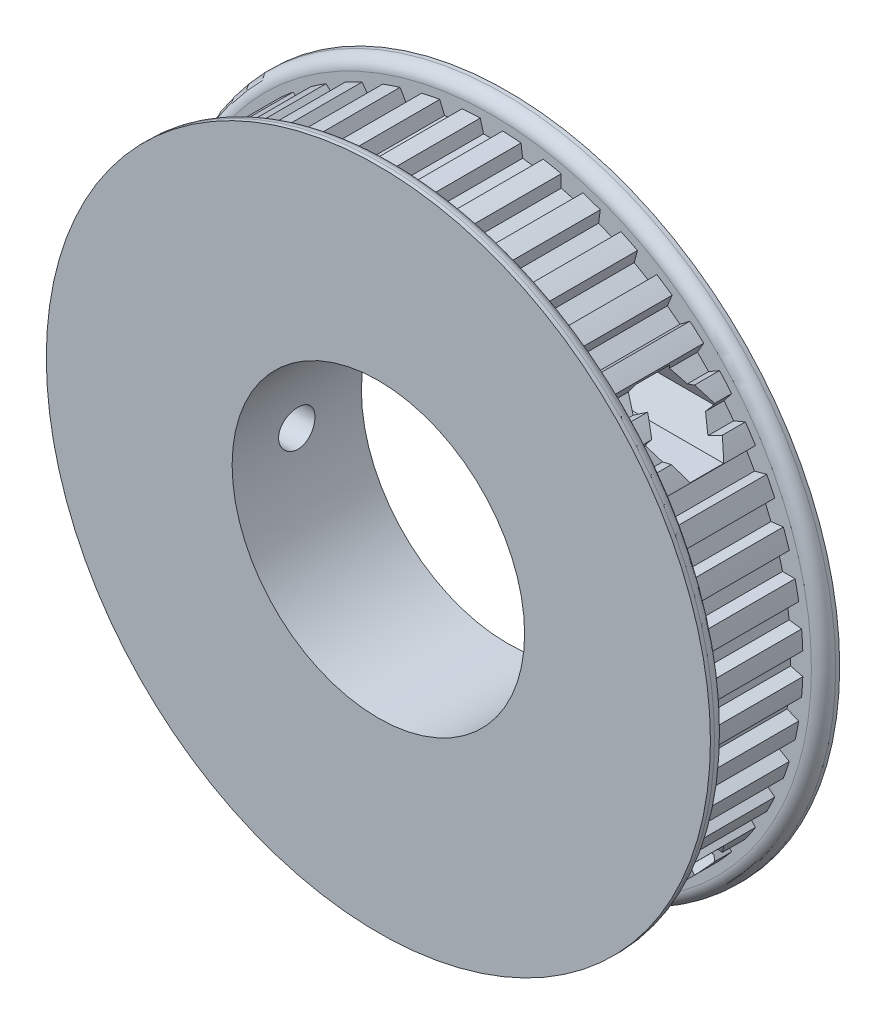
from build123d import *

# Parameters (mm, degrees)
SKETCH1_R               = 38.5572
BOSS_EXTRUDE1_DEPTH     = 6
CUT_EXTRUDE3_DEPTH      = 55.857226905
CUT_EXTRUDE3_DEPTH_BACK = 55.857226905
SKETCH6_R               = 18.1
SKETCH11_R              = 2.25
CUT_EXTRUDE4_DEPTH      = 55.857226905
CUT_EXTRUDE5_START      = -5
SKETCH12_R              = 4
CUT_EXTRUDE5_DEPTH      = 50.857227056
CUT_EXTRUDE6_START      = 5
CUT_EXTRUDE6_DEPTH      = 50.857227056
CUT_EXTRUDE8_START      = -38.557200101
CUT_EXTRUDE8_OUTLINE_R  = 2.25
CUT_EXTRUDE8_DEPTH      = 20.597592743
CUT_EXTRUDE9_START      = -25
SKETCH16_R              = 3.75
CUT_EXTRUDE9_DEPTH      = 30.857227127
CUT_EXTRUDE7_DEPTH      = 55.857227056
CIRPATTERN2_COUNT       = 48
SKETCH19_W              = 2
SKETCH19_H              = 23
FILLET2_R               = 1.5
FILLET2_OF_MIRROR2_R    = 1.5


# Read off the part's stored shape, not the designer's step: Cut-Extrude8
with BuildPart() as part:
    # Sketch1 → Boss-Extrude1 (new, symmetric)
    with BuildSketch(Plane.XY):
        Circle(SKETCH1_R)
    extrude(amount=BOSS_EXTRUDE1_DEPTH, both=True)

    # Sketch6 → Cut-Extrude3 (cut, two sides: drawn at the far end of the back side and taken through both)
    with BuildSketch(Plane.XY.offset(-CUT_EXTRUDE3_DEPTH_BACK)):
        Circle(SKETCH6_R)
    extrude(amount=CUT_EXTRUDE3_DEPTH + CUT_EXTRUDE3_DEPTH_BACK, mode=Mode.SUBTRACT)

    # Sketch11 → Cut-Extrude4 (cut, symmetric)
    with BuildSketch(Plane(origin=(0, 0, 0), x_dir=(0, 0, -1), z_dir=(1, 0, 0))):
        with Locations((0, 24.1)):
            Circle(SKETCH11_R)
    cut_extrude4 = extrude(amount=CUT_EXTRUDE4_DEPTH, both=True, mode=Mode.SUBTRACT)

    # Sketch12 → Cut-Extrude5 (cut, through all)
    with BuildSketch(Plane(origin=(0, 0, 0), x_dir=(0, 0, -1), z_dir=(1, 0, 0)).offset(CUT_EXTRUDE5_START)):
        with Locations((0, 24.1)):
            Circle(SKETCH12_R)
    cut_extrude5 = extrude(amount=-CUT_EXTRUDE5_DEPTH, mode=Mode.SUBTRACT)

    # Sketch13 → Cut-Extrude6 (cut, through all)
    with BuildSketch(Plane(origin=(0, 0, 0), x_dir=(0, 0, -1), z_dir=(1, 0, 0)).offset(CUT_EXTRUDE6_START)):
        Polygon((2.078460969, 20.5), (4.156921938, 24.1), (2.078460969, 27.7), (-2.078460969, 27.7), (-4.156921938, 24.1), (-2.078460969, 20.5), align=None)
    cut_extrude6 = extrude(amount=CUT_EXTRUDE6_DEPTH, mode=Mode.SUBTRACT)

    # Cut-Extrude8 outline → Cut-Extrude8 (cut)
    with BuildSketch(Plane(origin=(0, 0, 0), x_dir=(0, 0, -1), z_dir=(1, 0, 0)).offset(CUT_EXTRUDE8_START)):
        Circle(CUT_EXTRUDE8_OUTLINE_R)
    extrude(amount=CUT_EXTRUDE8_DEPTH, mode=Mode.SUBTRACT)

    # Sketch16 → Cut-Extrude9 (cut, through all)
    with BuildSketch(Plane(origin=(0, 0, 0), x_dir=(0, 0, -1), z_dir=(1, 0, 0)).offset(CUT_EXTRUDE9_START)):
        Circle(SKETCH16_R)
    extrude(amount=-CUT_EXTRUDE9_DEPTH, mode=Mode.SUBTRACT)

    # Mirror1: Cut-Extrude4, Cut-Extrude5, Cut-Extrude6 across plane
    add(cut_extrude4.mirror(Plane.ZX), mode=Mode.SUBTRACT)
    add(cut_extrude5.mirror(Plane.ZX), mode=Mode.SUBTRACT)
    add(cut_extrude6.mirror(Plane.ZX), mode=Mode.SUBTRACT)

    # Sketch14 → Cut-Extrude7 (cut, symmetric)
    with BuildSketch(Plane.XY):
        with BuildLine():
            Line((-1.38479518, 38.532324277), (-0.98313934, 37.033324277))
            Line((-0.98313934, 37.033324277), (0.98313934, 37.033324277))
            Line((0.98313934, 37.033324277), (1.38479518, 38.532324277))
            ThreePointArc((1.38479518, 38.532324277), (0, 38.5572), (-1.38479518, 38.532324277))
        make_face()
    cut_extrude7 = extrude(amount=CUT_EXTRUDE7_DEPTH, both=True, mode=Mode.SUBTRACT)

    # CirPattern2: Cut-Extrude7 ×48 about axis
    cirpattern2_axis = Axis((0, 0, 0), (0, 0, 1))
    for i in range(1, CIRPATTERN2_COUNT):
        add(cut_extrude7.rotate(cirpattern2_axis, i * 360 / CIRPATTERN2_COUNT), mode=Mode.SUBTRACT)

    # Sketch19 → Revolve1 (revolve)
    with BuildSketch(Plane(origin=(0, 0, 0), x_dir=(0, 0, -1), z_dir=(1, 0, 0)), mode=Mode.PRIVATE) as revolve1_sk:
        with Locations((7, 29.6)):
            Rectangle(SKETCH19_W, SKETCH19_H)
    revolve1 = revolve(revolve1_sk.sketch.rotate(Axis((0, 0, -15.769652086), (0, 0, 1)), 270), axis=Axis((0, 0, -15.769652086), (0, 0, 1)))

    # Fillet2
    fillet2_edges = [part.edges().sort_by_distance(p)[0] for p in [
        (-41.1, 0, -6),
    ]]
    fillet(fillet2_edges, radius=FILLET2_R)

    # Mirror2: Revolve1 across plane
    add(revolve1.mirror(Plane.XY))

    # Fillet2 of Mirror2
    fillet2_of_mirror2_edges = [part.edges().sort_by_distance(p)[0] for p in [
        (-41.1, 0, 6),
    ]]
    fillet(fillet2_of_mirror2_edges, radius=FILLET2_OF_MIRROR2_R)


solid = part.part
